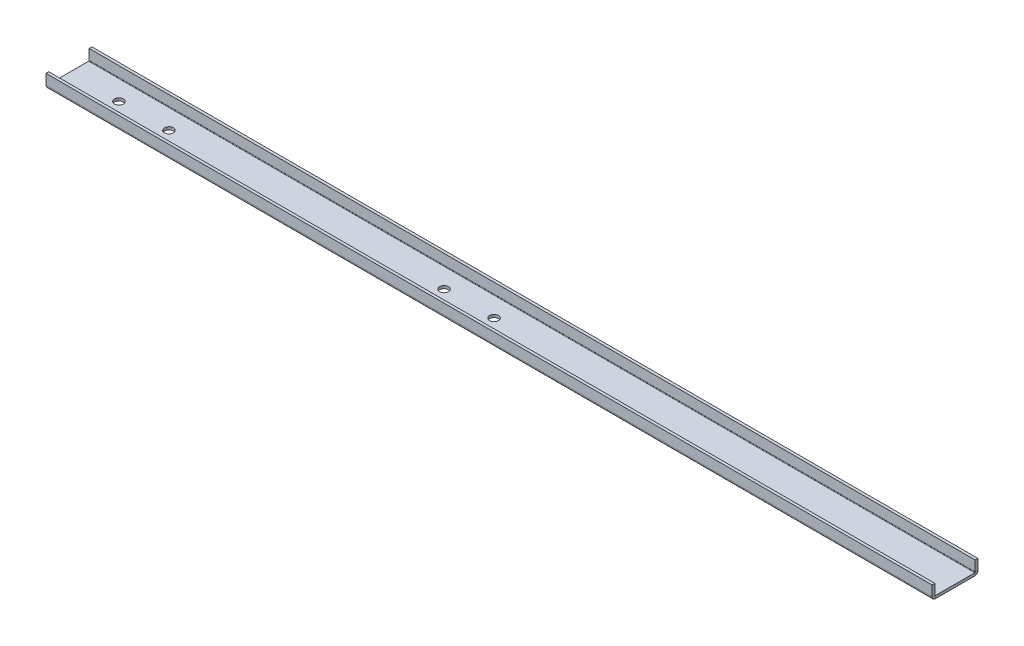
from build123d import *

# Parameters (mm, degrees)
BASE_FLANGE1_DEPTH = 450
SKETCH3_R          = 2.25425
CUT_EXTRUDE1_DEPTH = 1.4


# Sheet-metal steps are written as plain solids
with BuildPart() as part:
    # Sketch2 → Base-Flange1 (new body)
    with BuildSketch(Plane(origin=(0, 0, 0), x_dir=(0, 0, -1), z_dir=(1, 0, 0))):
        with BuildLine():
            Line((1.875, 7.1), (1.875, 1.85))
            ThreePointArc((1.875, 1.85), (1.948223305, 1.673223305), (2.125, 1.6))
            Line((2.125, 1.6), (22.125, 1.6))
            ThreePointArc((22.125, 1.6), (22.301776695, 1.673223305), (22.375, 1.85))
            Line((22.375, 1.85), (22.375, 7.1))
            Line((22.375, 7.1), (23.775, 7.1))
            Line((23.775, 7.1), (23.775, 1.85))
            ThreePointArc((23.775, 1.85), (23.291726189, 0.683273811), (22.125, 0.2))
            Line((22.125, 0.2), (2.125, 0.2))
            ThreePointArc((2.125, 0.2), (0.958273811, 0.683273811), (0.475, 1.85))
            Line((0.475, 1.85), (0.475, 7.1))
            Line((0.475, 7.1), (1.875, 7.1))
        make_face()
    extrude(amount=BASE_FLANGE1_DEPTH)

    # Sketch3 → Cut-Extrude1 (cut)
    with BuildSketch(Plane.XZ.offset(-0.2)):
        with Locations(Location((25.4, -12.125, 0), (0, 0, 270))):
            Circle(SKETCH3_R)
        with Locations(Location((50.8, -12.125, 0), (0, 0, 270))):
            Circle(SKETCH3_R)
        with Locations(Location((215.9, -12.125, 0), (0, 0, 270))):
            Circle(SKETCH3_R)
        with Locations(Location((190.5, -12.125, 0), (0, 0, 270))):
            Circle(SKETCH3_R)
    extrude(amount=-CUT_EXTRUDE1_DEPTH, mode=Mode.SUBTRACT)


solid = part.part
